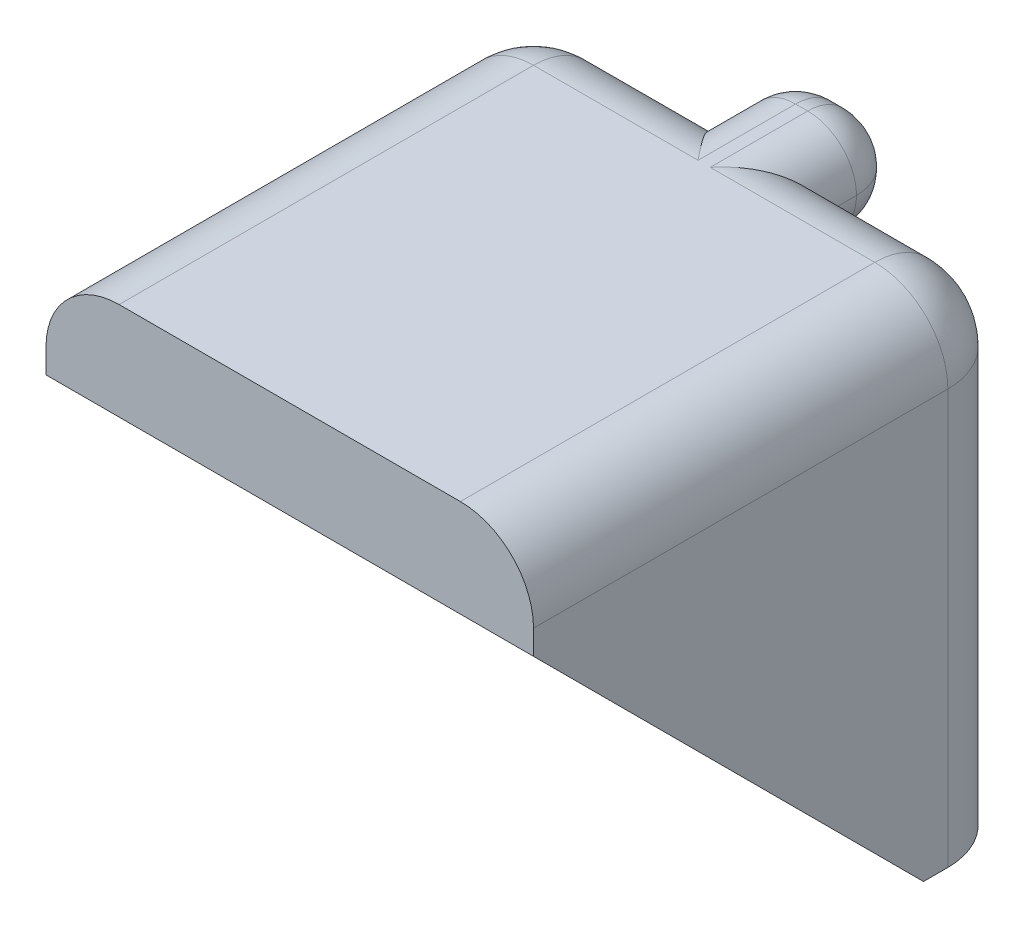
from build123d import *

# Parameters (mm, degrees)
ESQUISSE1_W        = 20
ESQUISSE1_H        = 20
ESQUISSE1_R        = 2
BOSS_EXTRU_1_DEPTH = 4
ESQUISSE2_W        = 20
ESQUISSE2_H        = 20
BOSS_EXTRU_2_DEPTH = 4
BOSS_EXTRU_3_DEPTH = 4
BOSS_EXTRU_4_DEPTH = 4
ESQUISSE5_W        = 4.5
ESQUISSE5_H        = 4
BOSS_EXTRU_5_DEPTH = 3
CONG_1_R           = 3
CONG_2_R           = 2


with BuildPart() as part:
    # Esquisse1 → Boss.-Extru.1 (new body)
    with BuildSketch(Plane.XY):
        Rectangle(ESQUISSE1_W, ESQUISSE1_H)
        with Locations((0, -4)):
            Circle(ESQUISSE1_R, mode=Mode.SUBTRACT)
    extrude(amount=BOSS_EXTRU_1_DEPTH)

    # Esquisse2 → Boss.-Extru.2 (add)
    with BuildSketch(Plane(origin=(0, 10, 0), x_dir=(1, 0, 0), z_dir=(0, 1, 0))):
        with Locations((0, -10)):
            Rectangle(ESQUISSE2_W, ESQUISSE2_H)
    extrude(amount=-BOSS_EXTRU_2_DEPTH)

    # Esquisse3 → Boss.-Extru.3 (add)
    with BuildSketch(Plane.ZY.offset(10)):
        Polygon((4, -10), (20, 6), (4, 6), align=None)
    extrude(amount=-BOSS_EXTRU_3_DEPTH)

    # Esquisse4 → Boss.-Extru.4 (add)
    with BuildSketch(Plane(origin=(10, 0, 0), x_dir=(0, 0, -1), z_dir=(1, 0, 0))):
        Polygon((-20, 6), (-4, 6), (-4, -10), align=None)
    extrude(amount=-BOSS_EXTRU_4_DEPTH)

    # Esquisse5 → Boss.-Extru.5 (add)
    with BuildSketch(Plane(origin=(0, 0, 0), x_dir=(-1, 0, 0), z_dir=(0, 0, -1))):
        with Locations((0, 8)):
            Rectangle(ESQUISSE5_W, ESQUISSE5_H)
    extrude(amount=BOSS_EXTRU_5_DEPTH)

    # Congé1
    cong_1_edges = [part.edges().sort_by_distance(p)[0] for p in [
        (6.125, 10, 0),
        (10, 0, 0),
        (-10, 0, 0),
        (-6.125, 10, 0),
        (-10, 10, 10),
        (10, 10, 10),
    ]]
    fillet(cong_1_edges, radius=CONG_1_R)

    # Congé2
    cong_2_edges = [part.edges().sort_by_distance(p)[0] for p in [
        (-2.25, 10, 0),
    ]]
    fillet(cong_2_edges, radius=CONG_2_R)
    cong_2_2_edges = [part.edges().sort_by_distance(p)[0] for p in [
        (1, 10, -3),
    ]]
    fillet(cong_2_2_edges, radius=CONG_2_R)
    cong_2_3_edges = [part.edges().sort_by_distance(p)[0] for p in [
        (2.25, 10, 1),
    ]]
    fillet(cong_2_3_edges, radius=CONG_2_R)
    cong_2_4_edges = [part.edges().sort_by_distance(p)[0] for p in [
        (-2.25, 6, -0.5),
    ]]
    fillet(cong_2_4_edges, radius=CONG_2_R - 0.0001)  # a hair under: the kernel refuses the full size


solid = part.part
